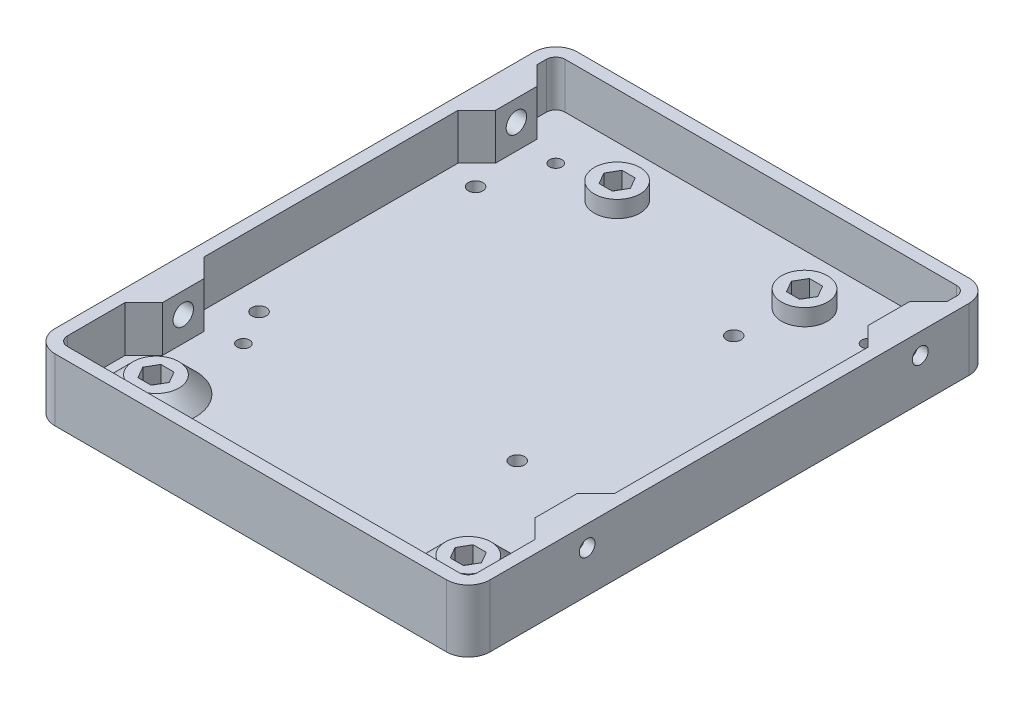
from build123d import *

# Parameters (mm, degrees)
SKETCH1_W           = 104.5
SKETCH1_H           = 125.5
BOSS_EXTRUDE1_DEPTH = 4
FILLET1_R           = 5.25
EXTRUDE_THIN1_START = 11
EXTRUDE_THIN1_DEPTH = 11
CUT_EXTRUDE2_REACH  = 138.387
SKETCH6_R           = 1.5
SKETCH8_W           = 10
SKETCH8_H           = 11
BOSS_EXTRUDE2_DEPTH = 4.5
CHAMFER2_SIZE       = 4.5
SKETCH5_R           = 1.9
CUT_EXTRUDE3_DEPTH  = 164.998475603
SKETCH10_R          = 2.45
CUT_EXTRUDE4_DEPTH  = 5
SKETCH2_R           = 5.5
BOSS_EXTRUDE3_DEPTH = 8
CUT_EXTRUDE5_DEPTH  = 137.386628743
SKETCH13_R          = 1.75
CUT_EXTRUDE6_DEPTH  = 137.386628743
CHAMFER3_SIZE       = 4
SKETCH14_R          = 1.75
CUT_EXTRUDE7_DEPTH  = 137.386628743


with BuildPart() as part:
    # Sketch1 → Boss-Extrude1 (new body)
    with BuildSketch(Plane(origin=(0, 0, 0), x_dir=(1, 0, 0), z_dir=(0, 1, 0))):
        with Locations((0, 62.75)):
            Rectangle(SKETCH1_W, SKETCH1_H)
    extrude(amount=BOSS_EXTRUDE1_DEPTH)

    # Fillet1
    fillet1_edges = [part.edges().sort_by_distance(p)[0] for p in [
        (-52.25, 2, -125.5),
        (52.25, 2, -125.5),
        (52.25, 2, 0),
        (-52.25, 2, 0),
    ]]
    fillet(fillet1_edges, radius=FILLET1_R)

    # Sketch3 → Extrude-Thin1 (add)
    with BuildSketch(Plane(origin=(0, 4, 0), x_dir=(1, 0, 0), z_dir=(0, 1, 0)).offset(EXTRUDE_THIN1_START)):
        with BuildLine():
            Line((47, 125.5), (-47, 125.5))
            ThreePointArc((-47, 125.5), (-50.712310601, 123.962310601), (-52.25, 120.25))
            Line((-52.25, 120.25), (-52.25, 5.25))
            ThreePointArc((-52.25, 5.25), (-50.712310601, 1.537689399), (-47, 0))
            Line((-47, 0), (47, 0))
            ThreePointArc((47, 0), (50.712310601, 1.537689399), (52.25, 5.25))
            Line((52.25, 5.25), (52.25, 120.25))
            ThreePointArc((52.25, 120.25), (50.712310601, 123.962310601), (47, 125.5))
        make_face()
        with BuildLine():
            Line((47, 122.5), (-47, 122.5))
            ThreePointArc((-47, 122.5), (-48.590990258, 121.840990258), (-49.25, 120.25))
            Line((-49.25, 120.25), (-49.25, 5.25))
            ThreePointArc((-49.25, 5.25), (-48.590990258, 3.659009742), (-47, 3))
            Line((-47, 3), (47, 3))
            ThreePointArc((47, 3), (48.590990258, 3.659009742), (49.25, 5.25))
            Line((49.25, 5.25), (49.25, 120.25))
            ThreePointArc((49.25, 120.25), (48.590990258, 121.840990258), (47, 122.5))
        make_face(mode=Mode.SUBTRACT)
    extrude(amount=-EXTRUDE_THIN1_DEPTH)

    # Sketch6 → Cut-Extrude2 (cut, up to next)
    with BuildSketch(Plane(origin=(0, 4, 0), x_dir=(1, 0, 0), z_dir=(0, 1, 0)), mode=Mode.PRIVATE) as cut_extrude2_sk1:
        with Locations(Location((-37.5, 110.75, 0), (0, 0, 270))):
            Circle(SKETCH6_R)
    cut_extrude2_tool1 = extrude(cut_extrude2_sk1.sketch, amount=-CUT_EXTRUDE2_REACH, mode=Mode.PRIVATE) & part.part
    # Sketch6 → Cut-Extrude2 (cut, up to next)
    with BuildSketch(Plane(origin=(0, 4, 0), x_dir=(1, 0, 0), z_dir=(0, 1, 0)), mode=Mode.PRIVATE) as cut_extrude2_sk2:
        with Locations(Location((37.5, 110.75, 0), (0, 0, 270))):
            Circle(SKETCH6_R)
    cut_extrude2_tool2 = extrude(cut_extrude2_sk2.sketch, amount=-CUT_EXTRUDE2_REACH, mode=Mode.PRIVATE) & part.part
    # Sketch6 → Cut-Extrude2 (cut, up to next)
    with BuildSketch(Plane(origin=(0, 4, 0), x_dir=(1, 0, 0), z_dir=(0, 1, 0)), mode=Mode.PRIVATE) as cut_extrude2_sk3:
        with Locations(Location((37.5, 35.75, 0), (0, 0, 270))):
            Circle(SKETCH6_R)
    cut_extrude2_tool3 = extrude(cut_extrude2_sk3.sketch, amount=-CUT_EXTRUDE2_REACH, mode=Mode.PRIVATE) & part.part
    # Sketch6 → Cut-Extrude2 (cut, up to next)
    with BuildSketch(Plane(origin=(0, 4, 0), x_dir=(1, 0, 0), z_dir=(0, 1, 0)), mode=Mode.PRIVATE) as cut_extrude2_sk4:
        with Locations(Location((-37.5, 35.75, 0), (0, 0, 270))):
            Circle(SKETCH6_R)
    cut_extrude2_tool4 = extrude(cut_extrude2_sk4.sketch, amount=-CUT_EXTRUDE2_REACH, mode=Mode.PRIVATE) & part.part
    add(cut_extrude2_tool1.solids().sort_by_distance((-37.5, 4, -110.75))[0], mode=Mode.SUBTRACT)
    add(cut_extrude2_tool2.solids().sort_by_distance((37.5, 4, -110.75))[0], mode=Mode.SUBTRACT)
    add(cut_extrude2_tool3.solids().sort_by_distance((37.5, 4, -35.75))[0], mode=Mode.SUBTRACT)
    add(cut_extrude2_tool4.solids().sort_by_distance((-37.5, 4, -35.75))[0], mode=Mode.SUBTRACT)

    # Sketch8 → Boss-Extrude2 (add)
    with BuildSketch(Plane(origin=(-49.25, 0, 0), x_dir=(0, 0, -1), z_dir=(1, 0, 0))):
        with Locations((28.55, 9.5)):
            Rectangle(SKETCH8_W, SKETCH8_H)
        with Locations((108.55, 9.5)):
            Rectangle(SKETCH8_W, SKETCH8_H)
    boss_extrude2 = extrude(amount=BOSS_EXTRUDE2_DEPTH)

    # Mirror4: Boss-Extrude2 across plane
    add(boss_extrude2.mirror(Plane(origin=(0, 0, 0), x_dir=(0, 0, 1), z_dir=(1, 0, 0))))

    # Chamfer2
    chamfer2_edges = [part.edges().sort_by_distance(p)[0] for p in [
        (-49.25, 9.5, -113.55),
        (-49.25, 9.5, -103.55),
        (-49.25, 9.5, -33.55),
        (-49.25, 9.5, -23.55),
        (49.25, 9.5, -113.55),
        (49.25, 9.5, -103.55),
        (49.25, 9.5, -23.55),
        (49.25, 9.5, -33.55),
    ]]
    chamfer(chamfer2_edges, length=CHAMFER2_SIZE - 0.0001)  # a hair under: the kernel refuses the full size

    # Sketch5 → Cut-Extrude3 (cut, through all)
    with BuildSketch(Plane.ZY.offset(52.25)):
        with Locations((-108.55, 10)):
            Circle(SKETCH5_R)
        with Locations((-28.55, 10)):
            Circle(SKETCH5_R)
    extrude(amount=-CUT_EXTRUDE3_DEPTH, mode=Mode.SUBTRACT)

    # Sketch10 → Cut-Extrude4 (cut)
    with BuildSketch(Plane(origin=(-44.75, 0, 0), x_dir=(0, 0, -1), z_dir=(1, 0, 0))):
        with Locations((28.55, 10)):
            Circle(SKETCH10_R)
        with Locations((108.55, 10)):
            Circle(SKETCH10_R)
    cut_extrude4 = extrude(amount=-CUT_EXTRUDE4_DEPTH, mode=Mode.SUBTRACT)

    # Sketch2 → Boss-Extrude3 (add)
    with BuildSketch(Plane.XZ):
        with Locations(Location((-37.5, -14.75, 0), (0, 0, 90))):
            Circle(SKETCH2_R)
        with Locations(Location((37.5, -14.75, 0), (0, 0, 90))):
            Circle(SKETCH2_R)
        with Locations(Location((-22.5, -110.5, 0), (0, 0, 90))):
            Circle(SKETCH2_R)
        with Locations(Location((22.5, -110.5, 0), (0, 0, 90))):
            Circle(SKETCH2_R)
    extrude(amount=-BOSS_EXTRUDE3_DEPTH)

    # Sketch12 → Cut-Extrude5 (cut, through all)
    with BuildSketch(Plane(origin=(0, 4, 0), x_dir=(1, 0, 0), z_dir=(0, 1, 0))):
        Polygon((-34.324573519, 14.75), (-35.91228676, 17.5), (-39.08771324, 17.5), (-40.675426481, 14.75), (-39.08771324, 12), (-35.91228676, 12), align=None)
        Polygon((35.91228676, 12), (34.324573519, 14.75), (35.91228676, 17.5), (39.08771324, 17.5), (40.675426481, 14.75), (39.08771324, 12), align=None)
        Polygon((25.675426481, 110.5), (24.08771324, 107.75), (20.91228676, 107.75), (19.324573519, 110.5), (20.91228676, 113.25), (24.08771324, 113.25), align=None)
        Polygon((-19.324573519, 110.5), (-20.91228676, 113.25), (-24.08771324, 113.25), (-25.675426481, 110.5), (-24.08771324, 107.75), (-20.91228676, 107.75), align=None)
    extrude(amount=CUT_EXTRUDE5_DEPTH, mode=Mode.SUBTRACT)

    # Sketch13 → Cut-Extrude6 (cut, through all)
    with BuildSketch(Plane(origin=(0, 4, 0), x_dir=(1, 0, 0), z_dir=(0, 1, 0))):
        with Locations(Location((37.5, 14.75, 0), (0, 0, 270))):
            Circle(SKETCH13_R)
        with Locations(Location((-37.5, 14.75, 0), (0, 0, 270))):
            Circle(SKETCH13_R)
        with Locations(Location((-22.5, 110.5, 0), (0, 0, 270))):
            Circle(SKETCH13_R)
        with Locations(Location((22.5, 110.5, 0), (0, 0, 270))):
            Circle(SKETCH13_R)
    extrude(amount=-CUT_EXTRUDE6_DEPTH, mode=Mode.SUBTRACT)

    # Chamfer3
    chamfer3_edges = [part.edges().sort_by_distance(p)[0] for p in [
        (-37.5, 4, -20.25),
        (37.5, 4, -20.25),
    ]]
    chamfer(chamfer3_edges, length=CHAMFER3_SIZE - 0.0001)  # a hair under: the kernel refuses the full size

    # Sketch14 → Cut-Extrude7 (cut, through all)
    with BuildSketch(Plane(origin=(0, 4, 0), x_dir=(1, 0, 0), z_dir=(0, 1, 0))):
        with Locations(Location((-42.25, 96.25, 0), (0, 0, 270))):
            Circle(SKETCH14_R)
        with Locations(Location((19.75, 96.25, 0), (0, 0, 270))):
            Circle(SKETCH14_R)
        with Locations(Location((19.75, 44.25, 0), (0, 0, 270))):
            Circle(SKETCH14_R)
        with Locations(Location((-42.25, 44.25, 0), (0, 0, 270))):
            Circle(SKETCH14_R)
    extrude(amount=-CUT_EXTRUDE7_DEPTH, mode=Mode.SUBTRACT)

    # Mirror5: Cut-Extrude4 across plane
    add(cut_extrude4.mirror(Plane(origin=(0, 0, 0), x_dir=(0, 0, 1), z_dir=(1, 0, 0))), mode=Mode.SUBTRACT)


solid = part.part
